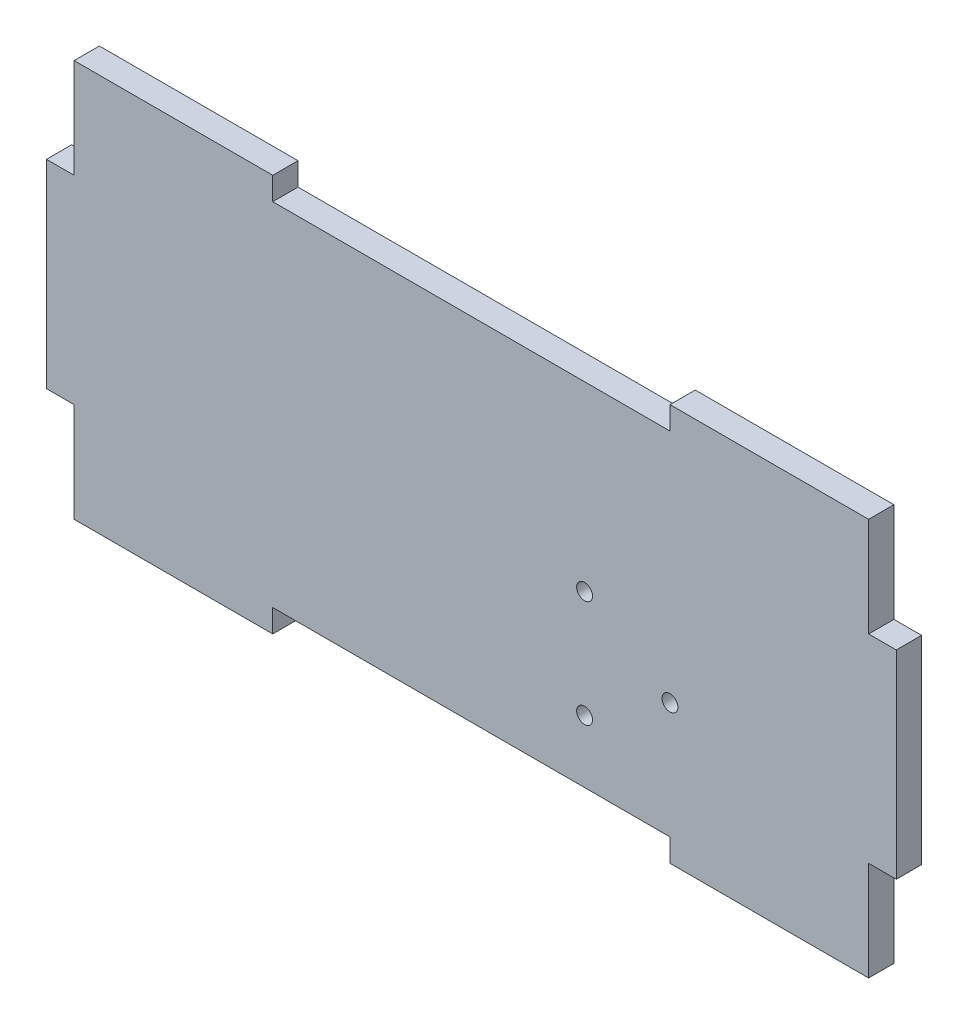
from build123d import *

# Parameters (mm, degrees)
SKETCH1_W           = 200
SKETCH1_H           = 100
BOSS_EXTRUDE1_DEPTH = 6.36
SKETCH9_W           = 6.96
SKETCH9_H           = 50
BOSS_EXTRUDE5_DEPTH = 6.36
SKETCH10_W          = 100
SKETCH10_H          = 5.76
CUT_EXTRUDE1_DEPTH  = 119.240818671
SKETCH13_R          = 2
BATTERY_HOLES_DEPTH = 10


with BuildPart() as part:
    # Sketch1 → Boss-Extrude1 (new body)
    with BuildSketch(Plane.XY):
        Rectangle(SKETCH1_W, SKETCH1_H)
    extrude(amount=BOSS_EXTRUDE1_DEPTH)

    # Sketch9 → Boss-Extrude5 (add)
    with BuildSketch(Plane(origin=(0, 0, 0), x_dir=(-1, 0, 0), z_dir=(0, 0, -1))):
        with Locations((103.48, 0)):
            Rectangle(SKETCH9_W, SKETCH9_H)
    boss_extrude5 = extrude(amount=-BOSS_EXTRUDE5_DEPTH)

    # Mirror5: Boss-Extrude5 across plane
    add(boss_extrude5.mirror(Plane(origin=(0, 0, 0), x_dir=(0, 0, 1), z_dir=(1, 0, 0))))

    # Sketch10 → Cut-Extrude1 (cut, symmetric)
    with BuildSketch(Plane.XY.offset(6.36)):
        with Locations((0, 47.12)):
            Rectangle(SKETCH10_W, SKETCH10_H)
    cut_extrude1 = extrude(amount=CUT_EXTRUDE1_DEPTH, both=True, mode=Mode.SUBTRACT)

    # Mirror6: Cut-Extrude1 across plane
    add(cut_extrude1.mirror(Plane.ZX), mode=Mode.SUBTRACT)

    # Sketch13 → battery holes (cut)
    with BuildSketch(Plane.XY.offset(6.36)):
        with Locations((50, -15)):
            Circle(SKETCH13_R)
        with Locations((28.5, -1.5)):
            Circle(SKETCH13_R)
        with Locations((28.5, -28.5)):
            Circle(SKETCH13_R)
    extrude(amount=-BATTERY_HOLES_DEPTH, mode=Mode.SUBTRACT)


solid = part.part
